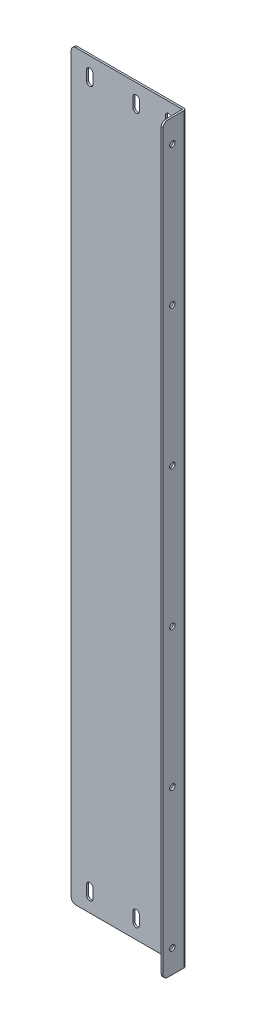
from build123d import *

# Parameters (mm, degrees)
SKETCH_1_W                       = 245
SKETCH_1_H                       = 800
SM_BASE_FLANGE_1_DEPTH           = 2
FILLET_1_R                       = 5
SKETCH_2_W                       = 1
SKETCH_2_H                       = 854.013811654
CUT_EXTRUDE_1_DEPTH              = 10
SKETCH_3_W                       = 130
SKETCH_3_H                       = 800.320249097
CUT_EXTRUDE_2_DEPTH              = 10
SM_EDGE_FLANGE_1_STRIP_W         = 9.4732
SM_EDGE_FLANGE_1_STRIP_H         = 2
SM_EDGE_FLANGE_1_STRIP_CUT_DEPTH = 800
SM_EDGE_FLANGE_1_DEPTH           = 800
FILLET_2_R                       = 5
CUT_EXTRUDE_3_DEPTH              = 10
HOLE_WIZARD_6_0_6_1_D            = 6
PATTERN_LINEAR_1_COUNT           = 6
PATTERN_LINEAR_1_PITCH           = 150


# Sheet-metal steps are written as plain solids
with BuildPart() as part:
    # Sketch 1 → 基体-法兰1 (new body)
    with BuildSketch(Plane.XY):
        Rectangle(SKETCH_1_W, SKETCH_1_H)
    extrude(amount=-SM_BASE_FLANGE_1_DEPTH)

    # 圆角1
    fillet_1_edges = [part.edges().sort_by_distance(p)[0] for p in [
        (-122.5, 400, -1),
        (122.5, 400, -1),
        (122.5, -400, -1),
        (-122.5, -400, -1),
    ]]
    fillet(fillet_1_edges, radius=FILLET_1_R)

    # Sketch 2 → 切除-拉伸1 (cut)
    with BuildSketch(Plane.XY):
        Rectangle(SKETCH_2_W, SKETCH_2_H)
    extrude(amount=-CUT_EXTRUDE_1_DEPTH, mode=Mode.SUBTRACT)


with BuildPart() as cut_extrude_1_piece_1:
    # of the separate pieces the step leaves, piece 1, a body of its own (cut_extrude_1_pieces)
    add(part.part.solids().sort_by_distance((-0.5, -400, 0))[0])

    # 边线-法兰1 strip (across the edge) → 边线-法兰1 strip cut (cut)
    with BuildSketch(Plane(origin=(-0.5, -400, 0), x_dir=(-1, 0, 0), z_dir=(0, 1, 0))):
        with Locations((-2, -1)):
            Rectangle(SM_EDGE_FLANGE_1_STRIP_W, SM_EDGE_FLANGE_1_STRIP_H)
    extrude(amount=SM_EDGE_FLANGE_1_STRIP_CUT_DEPTH, mode=Mode.SUBTRACT)

    # 边线-法兰1 section (across the edge) → 边线-法兰1 (add)
    with BuildSketch(Plane(origin=(-0.5, -400, 0), x_dir=(-1, 0, 0), z_dir=(0, 1, 0))):
        with BuildLine():
            Line((0, 0.7366), (0, 23))
            Line((0, 23), (2, 23))
            Line((2, 23), (2, 0.7366))
            ThreePointArc((2, 0.7366), (2.215745145, 0.215745145), (2.7366, 0))
            Line((2.7366, 0), (2.7366, -2))
            ThreePointArc((2.7366, -2), (0.801531583, -1.198468417), (0, 0.7366))
        make_face()
    extrude(amount=SM_EDGE_FLANGE_1_DEPTH)

    # 圆角2
    fillet_2_edges = [cut_extrude_1_piece_1.edges().sort_by_distance(p)[0] for p in [
        (-1.5, -400, 23),
        (-1.5, 400, 23),
    ]]
    fillet(fillet_2_edges, radius=FILLET_2_R)

    # 草图9 → 切除-拉伸3 (cut)
    with BuildSketch(Plane.XY):
        with BuildLine():
            Line((-99, 385), (-99, 375))
            ThreePointArc((-99, 375), (-102.5, 371.5), (-106, 375))
            Line((-106, 375), (-106, 385))
            ThreePointArc((-106, 385), (-102.5, 388.5), (-99, 385))
        make_face()
        with BuildLine():
            Line((-49, 385), (-49, 375))
            ThreePointArc((-49, 375), (-52.5, 371.5), (-56, 375))
            Line((-56, 375), (-56, 385))
            ThreePointArc((-56, 385), (-52.5, 388.5), (-49, 385))
        make_face()
        with BuildLine():
            Line((-106, -385), (-106, -375))
            ThreePointArc((-106, -375), (-102.5, -371.5), (-99, -375))
            Line((-99, -375), (-99, -385))
            ThreePointArc((-99, -385), (-102.5, -388.5), (-106, -385))
        make_face()
        with BuildLine():
            Line((-21, 375), (-21, 385))
            ThreePointArc((-21, 385), (-17.5, 388.5), (-14, 385))
            Line((-14, 385), (-14, 375))
            ThreePointArc((-14, 375), (-17.5, 371.5), (-21, 375))
        make_face()
        with BuildLine():
            Line((-14, -375), (-14, -385))
            ThreePointArc((-14, -385), (-17.5, -388.5), (-21, -385))
            Line((-21, -385), (-21, -375))
            ThreePointArc((-21, -375), (-17.5, -371.5), (-14, -375))
        make_face()
        with BuildLine():
            Line((-56, -385), (-56, -375))
            ThreePointArc((-56, -375), (-52.5, -371.5), (-49, -375))
            Line((-49, -375), (-49, -385))
            ThreePointArc((-49, -385), (-52.5, -388.5), (-56, -385))
        make_face()
    extrude(amount=-CUT_EXTRUDE_3_DEPTH, mode=Mode.SUBTRACT)

    # Ø6.0 (6) 直径孔1 (through all)
    with Locations(Plane.ZY.offset(2.5)):
        with Locations((13, 375)):
            hole_wizard_6_0_6_1 = Hole(HOLE_WIZARD_6_0_6_1_D / 2)

    # 阵列(线性)1: Ø6.0 (6) 直径孔1 ×6
    with Locations(*[(0, -i * PATTERN_LINEAR_1_PITCH, 0) for i in range(1, PATTERN_LINEAR_1_COUNT)]):
        add(hole_wizard_6_0_6_1, mode=Mode.SUBTRACT)


with BuildPart() as cut_extrude_1_piece_2:
    # of the separate pieces the step leaves, piece 2, a body of its own (cut_extrude_1_pieces)
    add(part.part.solids().sort_by_distance((117.5, -400, 0))[0])

    # Sketch 3 → 切除-拉伸2 (cut)
    with BuildSketch(Plane.XY):
        with Locations((65.5, -0.160124549)):
            Rectangle(SKETCH_3_W, SKETCH_3_H)
    extrude(amount=-CUT_EXTRUDE_2_DEPTH, mode=Mode.SUBTRACT)


solid = cut_extrude_1_piece_1.part
